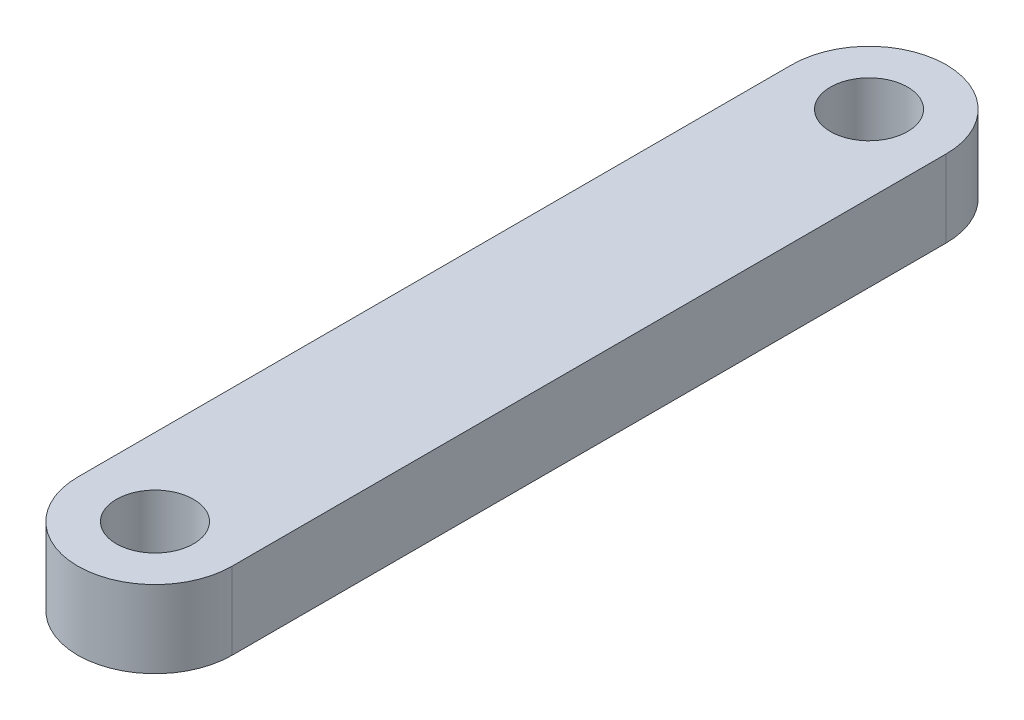
from build123d import *

# Parameters (mm, degrees)
SKETCH1_R           = 2
BOSS_EXTRUDE1_DEPTH = 4


with BuildPart() as part:
    # Sketch1 → Boss-Extrude1 (new body)
    with BuildSketch(Plane(origin=(0, 0, 0), x_dir=(1, 0, 0), z_dir=(0, 1, 0))):
        with BuildLine():
            Line((4, 18.5), (4, -18.5))
            ThreePointArc((4, -18.5), (0, -22.5), (-4, -18.5))
            Line((-4, -18.5), (-4, 18.5))
            ThreePointArc((-4, 18.5), (0, 22.5), (4, 18.5))
        make_face()
        with Locations((0, 18.5)):
            Circle(SKETCH1_R, mode=Mode.SUBTRACT)
        with Locations((0, -18.5)):
            Circle(SKETCH1_R, mode=Mode.SUBTRACT)
    extrude(amount=BOSS_EXTRUDE1_DEPTH)


solid = part.part
